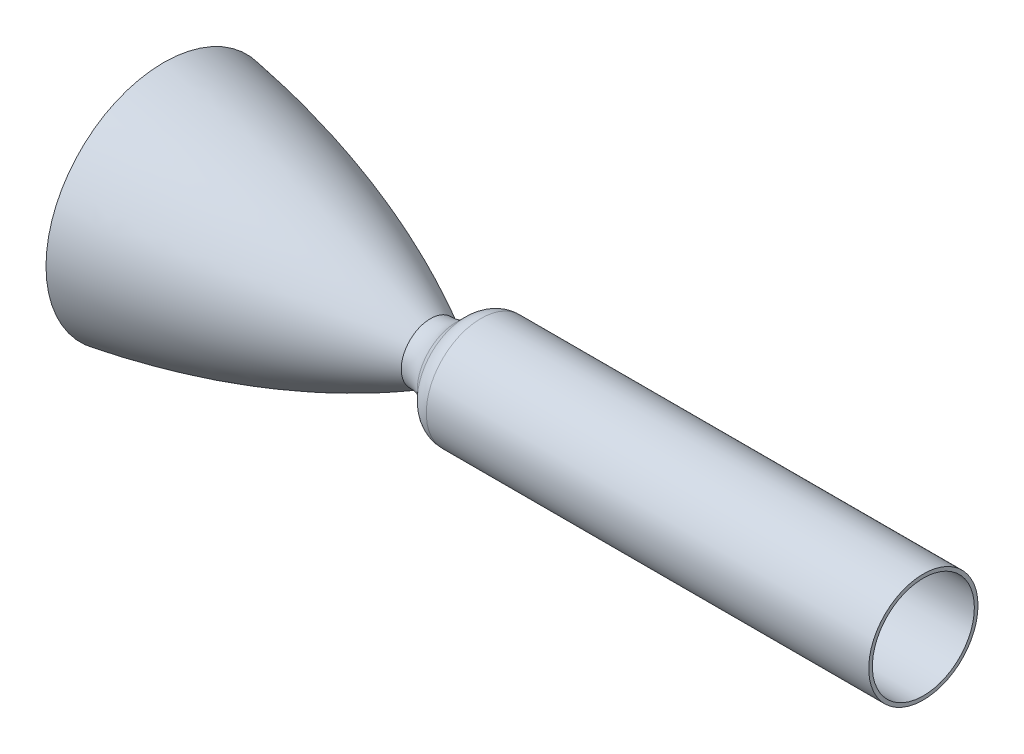
from build123d import *


with BuildPart() as part:
    # Sketch1 → Revolve1 (revolve)
    with BuildSketch(Plane.XY):
        with BuildLine():
            Line((29.403488888, 28), (272.332421076, 28))
            Line((272.332421076, 28), (272.332421076, 30))
            Line((272.332421076, 30), (29.403488888, 30))
            ThreePointArc((29.403488888, 30), (24.8112877, 29.08655439), (20.918207514, 26.485281374))
            Line((20.918207514, 26.485281374), (15.997897297, 21.564971157))
            ThreePointArc((15.997897297, 21.564971157), (9.419257453, 17.280239), (1.669952208, 16.020993162))
            add(Edge.make_bspline(
                [(1.669952208, 16.020993162), (-63.009835558, 51.501539943), (-144.815731722, 64.584786141)],
                knots=[-0.005551669, -0.005551669, -0.005551669, 1, 1, 1], degree=2))
            Line((-144.815731722, 64.584786141), (-145.131703302, 62.60990337))
            add(Edge.make_bspline(
                [(0, 14.654088062), (-64.080935915, 49.642177179), (-145.131703302, 62.60990337)],
                knots=[0, 0, 0, 1, 1, 1], degree=2))
            ThreePointArc((0, 14.654088062), (1.240358917, 14.166101456), (2.562868455, 14))
            ThreePointArc((2.562868455, 14), (10.599220534, 15.598529817), (17.41211086, 20.150757595))
            Line((17.41211086, 20.150757595), (22.332421076, 25.071067812))
            ThreePointArc((22.332421076, 25.071067812), (25.576654565, 27.238795325), (29.403488888, 28))
        make_face()
    revolve(axis=Axis((0, 0, 0), (-1, 0, 0)))


solid = part.part
